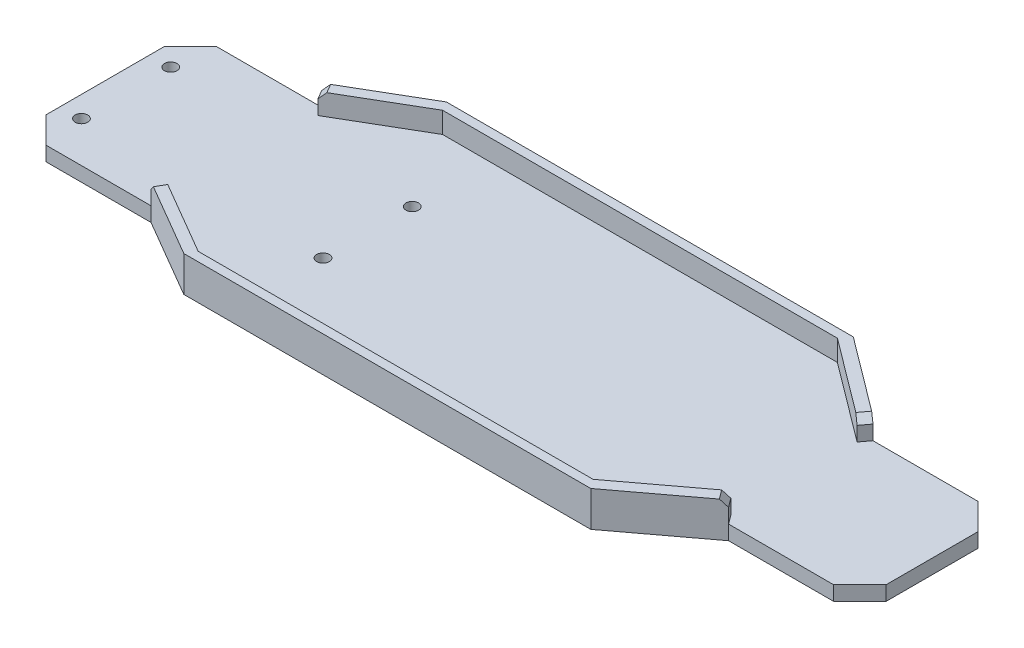
from build123d import *

# Parameters (mm, degrees)
BOSS_EXTRUDE1_DEPTH  = 5.5
CHASSIS_WALLS1_DEPTH = 8
CHAMFER1_SIZE        = 10
CHAMFER2_SIZE        = 10
CHAMFER3_SIZE        = 2.5
SKETCH4_R            = 2.4
CUT_EXTRUDE1_DEPTH   = 10


with BuildPart() as part:
    # Sketch1 → Boss-Extrude1 (new body)
    with BuildSketch(Plane(origin=(0, 0, 0), x_dir=(1, 0, 0), z_dir=(0, 1, 0))):
        Polygon((-107.5, 32.5), (-77.5, 50), (77.5, 50), (107.5, 27.5), (157.5, 27.5), (157.5, -27.5), (107.5, -27.5), (77.5, -50), (-77.5, -50), (-107.5, -32.5), (-157.5, -32.5), (-157.5, 32.5), align=None)
    extrude(amount=BOSS_EXTRUDE1_DEPTH)

    # Sketch3 → Chassis-Walls1 (add)
    with BuildSketch(Plane(origin=(0, 5.5, 0), x_dir=(1, 0, 0), z_dir=(0, 1, 0))):
        Polygon((0, 50), (-77.5, 50), (-107.5, 32.5), (-105.484515898, 29.044884396), (-75.484515898, 46.544884396), (0, 46.544884396), (74.908663297, 46.544884396), (104.908663297, 24.044884396), (107.5, 27.5), (77.5, 50), align=None)
        Polygon((74.908663297, -46.544884396), (0, -46.544884396), (-75.484515898, -46.544884396), (-105.484515898, -29.044884396), (-107.5, -32.5), (-77.5, -50), (0, -50), (77.5, -50), (107.5, -27.5), (104.908663297, -24.044884396), align=None)
    extrude(amount=CHASSIS_WALLS1_DEPTH)

    # Chamfer1
    chamfer1_edges = [part.edges().sort_by_distance(p)[0] for p in [
        (-157.5, 2.75, -32.5),
        (-157.5, 2.75, 32.5),
    ]]
    chamfer(chamfer1_edges, length=CHAMFER1_SIZE)

    # Chamfer2
    chamfer2_edges = [part.edges().sort_by_distance(p)[0] for p in [
        (157.5, 2.75, -27.5),
        (157.5, 2.75, 27.5),
    ]]
    chamfer(chamfer2_edges, length=CHAMFER2_SIZE)

    # Chamfer3
    chamfer3_edges = [part.edges().sort_by_distance(p)[0] for p in [
        (-106.492257949, 13.5, -30.772442198),
        (-106.492257949, 13.5, 30.772442198),
        (106.204331649, 13.5, 25.772442198),
        (106.204331649, 13.5, -25.772442198),
    ]]
    chamfer(chamfer3_edges, length=CHAMFER3_SIZE)

    # Sketch4 → Cut-Extrude1 (cut)
    with BuildSketch(Plane.XZ):
        with Locations((-149.5, 17)):
            Circle(SKETCH4_R)
        with Locations((-57.5, 17)):
            Circle(SKETCH4_R)
        with Locations((-57.5, -17)):
            Circle(SKETCH4_R)
        with Locations((-149.5, -17)):
            Circle(SKETCH4_R)
    extrude(amount=-CUT_EXTRUDE1_DEPTH, mode=Mode.SUBTRACT)


solid = part.part
